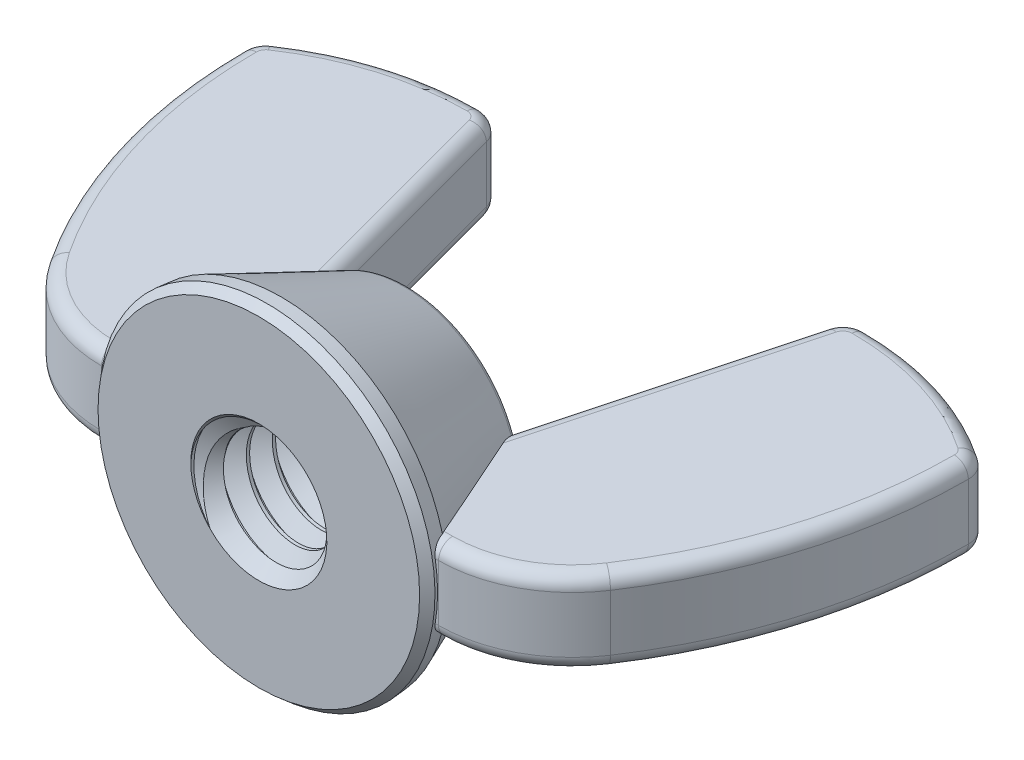
from build123d import *

# Parameters (mm, degrees)
EXTRUDE2_DEPTH     = 1.28984375
SKETCH3_R          = 5.159375
EXTRUDE1_DEPTH     = 0.6858
EXTRUDE1_DRAFT     = -5
SKETCH15_R         = 5.099375275
EXTRUDE3_DEPTH     = 3.8862
EXTRUDE3_TAPER     = 22.89012698
FILLET3_R          = 0.254
SKETCH4_R          = 2.0828
CUT_EXTRUDE1_DEPTH = 18.646438922
SWEEP1_PITCH       = 0.79375
SKETCH7_R          = 5.159375
CUT_EXTRUDE2_DEPTH = 18.646438952
SKETCH8_R          = 5.099375275
CUT_EXTRUDE3_DEPTH = 15.702761362
SKETCH11_R         = 2.032
CUT_EXTRUDE5_DEPTH = 15.702761327
CUT_EXTRUDE5_TAPER = 45
CHAMFER1_SIZE      = 0.257175
CHAMFER1_SIZE2     = 0.237388559
FILLET4_R          = 0.429947917


with BuildPart() as part:
    # Sketch13 → Extrude2 (new, symmetric)
    with BuildSketch(Plane(origin=(0, 0, 0), x_dir=(1, 0, 0), z_dir=(0, 1, 0))):
        with BuildLine():
            Line((3.166712045, 0.3429), (5.159375, 0.3429))
            ThreePointArc((5.159375, 0.3429), (7.101768744, 0.832103373), (8.580723973, 2.182993757))
            ThreePointArc((8.580723973, 2.182993757), (10.465874951, 6.208977734), (11.1125, 10.607183874))
            ThreePointArc((11.1125, 10.607183874), (11.028622602, 10.943597741), (10.796626512, 11.201255503))
            ThreePointArc((10.796626512, 11.201255503), (8.457534763, 12.316945036), (5.894454148, 12.7))
            ThreePointArc((5.894454148, 12.7), (5.458227968, 12.551921165), (5.202291154, 12.168884654))
            Line((5.202291154, 12.168884654), (3.166712045, 4.572))
            Line((3.166712045, 4.572), (3.166712045, 0.3429))
        make_face()
    extrude(amount=EXTRUDE2_DEPTH, both=True)

    # Fillet4
    fillet4_edges = [part.edges().sort_by_distance(p)[0] for p in [
        (7.101768744, 1.28984375, -0.832103373),
        (4.163043523, -1.28984375, -0.3429),
        (10.465874951, 1.28984375, -6.208977734),
        (11.028622602, 1.28984375, -10.943597741),
        (8.457534763, 1.28984375, -12.316945036),
        (5.458227968, 1.28984375, -12.551921165),
        (4.1845016, 1.28984375, -8.370442327),
        (4.163043523, 1.28984375, -0.3429),
        (4.1845016, -1.28984375, -8.370442327),
        (5.458227968, -1.28984375, -12.551921165),
        (8.457534763, -1.28984375, -12.316945036),
        (11.028622602, -1.28984375, -10.943597741),
        (10.465874951, -1.28984375, -6.208977734),
        (7.101768744, -1.28984375, -0.832103373),
    ]]
    fillet(fillet4_edges, radius=FILLET4_R)


with BuildPart() as body_2:
    # Sketch3 → Extrude1 (with draft: the straight prism first)
    with BuildSketch(Plane.XY):
        Circle(SKETCH3_R)
    extrude(amount=-EXTRUDE1_DEPTH)
    # Extrude1: the draft: its side faces are tilted about the plane it starts from
    extrude1_sides = [body_2.faces().sort_by_distance(p)[0] for p in [
        (-5.159375, 0, -0.3429),
    ]]
    draft(extrude1_sides, Plane.XY, EXTRUDE1_DRAFT)

    # Sketch15 → Extrude3 (add)
    with BuildSketch(Plane(origin=(0, 0, -0.6858), x_dir=(-1, 0, 0), z_dir=(0, 0, -1))):
        Circle(SKETCH15_R)
    extrude(amount=EXTRUDE3_DEPTH, taper=EXTRUDE3_TAPER)

    # Fillet3
    fillet3_edges = [body_2.edges().sort_by_distance(p)[0] for p in [
        (3.458569214, 0, -4.572),
    ]]
    fillet(fillet3_edges, radius=FILLET3_R)

    # Sketch4 → Cut-Extrude1 (cut, through all)
    with BuildSketch(Plane.XY):
        Circle(SKETCH4_R)
    extrude(amount=-CUT_EXTRUDE1_DEPTH, mode=Mode.SUBTRACT)

    # Sweep1: the profile of Sketch6 profile screwed along a right-hand helix of 9.76 turns, 6 arcs to a turn; built about Z, then put on its axis
    sweep1_z = Axis((0, 0, 0), (0, 0, 1))
    sweep1_corners = [(2.0831, 0, -0.694704455), (1.567244252, 0, -0.396875), (1.567244252, 0, -0.29765625), (2.0831, 0, 0.000173205)]
    with BuildLine(mode=Mode.PRIVATE) as sweep1_profile:
        Line(sweep1_corners[0], sweep1_corners[1])
        Line(sweep1_corners[1], sweep1_corners[2])
        Line(sweep1_corners[2], sweep1_corners[3])
        Line(sweep1_corners[3], sweep1_corners[0])
    sweep1_cap = Face(sweep1_profile.wire())
    sweep1_turn_angles = [0, 30, 60, 90, 120, 150, 180, 210, 240, 270, 300, 330, 360]
    sweep1_turn_weights = [1, 0.8660254037844387, 1, 0.8660254037844387, 1, 0.8660254037844387, 1, 0.8660254037844387, 1, 0.8660254037844387, 1, 0.8660254037844387, 1]
    sweep1_turn_rails = [Edge.make_bspline([Vector(p[0], p[1], 0).rotate(sweep1_z, sweep1_turn_angles[k]) / sweep1_turn_weights[k] + Vector(0, 0, p[2] + SWEEP1_PITCH * sweep1_turn_angles[k] / 360) for k in range(13)], [0, 0, 0, 1, 1, 2, 2, 3, 3, 4, 4, 5, 5, 6, 6, 6], 2, sweep1_turn_weights) for p in sweep1_corners]
    sweep1_turn_sides = [Face.make_surface_from_curves(sweep1_turn_rails[p[0]], sweep1_turn_rails[p[1]]) for p in [(0, 1), (1, 2), (2, 3), (3, 0)]]
    sweep1_turn = Solid(Shell([*sweep1_turn_sides, sweep1_cap, sweep1_cap.rotate(sweep1_z, 360).moved(Location((0, 0, SWEEP1_PITCH * 360 / 360)))]))
    sweep1_last_angles = [3240, 3270, 3300, 3330, 3360, 3390, 3420, 3450, 3480, 3496.8, 3513.6]
    sweep1_last_weights = [1, 0.8660254037844387, 1, 0.8660254037844387, 1, 0.8660254037844387, 1, 0.8660254037844387, 1, 0.9573194975320675, 1]
    sweep1_last_rails = [Edge.make_bspline([Vector(p[0], p[1], 0).rotate(sweep1_z, sweep1_last_angles[k]) / sweep1_last_weights[k] + Vector(0, 0, p[2] + SWEEP1_PITCH * sweep1_last_angles[k] / 360) for k in range(11)], [0, 0, 0, 1, 1, 2, 2, 3, 3, 4, 4, 5, 5, 5], 2, sweep1_last_weights) for p in sweep1_corners]
    sweep1_last_sides = [Face.make_surface_from_curves(sweep1_last_rails[p[0]], sweep1_last_rails[p[1]]) for p in [(0, 1), (1, 2), (2, 3), (3, 0)]]
    sweep1_last = Solid(Shell([*sweep1_last_sides, sweep1_cap.rotate(sweep1_z, 3240).moved(Location((0, 0, SWEEP1_PITCH * 3240 / 360))), sweep1_cap.rotate(sweep1_z, 3513.6).moved(Location((0, 0, SWEEP1_PITCH * 3513.6 / 360)))]))
    sweep1_each = [*[sweep1_turn.moved(Location((0, 0, SWEEP1_PITCH * i))) for i in range(9)], sweep1_last]
    add(Plane(origin=(0, 0, 0), x_dir=(-1, 0, 0), z_dir=(0, 0, -1)) * Compound([sweep1_each[i] for i in range(0, 10, 2)]))
    add(Plane(origin=(0, 0, 0), x_dir=(-1, 0, 0), z_dir=(0, 0, -1)) * Compound([sweep1_each[i] for i in range(1, 10, 2)]))

    # Sketch7 → Cut-Extrude2 (cut, through all)
    with BuildSketch(Plane.XY):
        Circle(SKETCH7_R)
    extrude(amount=CUT_EXTRUDE2_DEPTH, mode=Mode.SUBTRACT)

    # Sketch8 → Cut-Extrude3 (cut, through all)
    with BuildSketch(Plane.XY.offset(-4.572)):
        Circle(SKETCH8_R)
    extrude(amount=-CUT_EXTRUDE3_DEPTH, mode=Mode.SUBTRACT)

    # Cut-Extrude4 cone 1 section (through the dimple's axis) → Cut-Extrude4 (revolve, cut)
    with BuildSketch(Plane(origin=(0, 0, 0), x_dir=(0, -1, 0), z_dir=(1, 0, 0))):
        Polygon((0, 0), (2.0828, 0), (0, 2.0828), align=None)
    revolve(axis=Axis((0, 0, 0), (0, 0, -1)), mode=Mode.SUBTRACT)

    # Sketch11 → Cut-Extrude5 (cut, through all)
    with BuildSketch(Plane.XY.offset(-4.572)):
        Circle(SKETCH11_R)
    extrude(amount=CUT_EXTRUDE5_DEPTH, taper=CUT_EXTRUDE5_TAPER, mode=Mode.SUBTRACT)

    # Chamfer1
    chamfer1_edges = [body_2.edges().sort_by_distance(p)[0] for p in [
        (-5.159375, 0, 0),
    ]]
    chamfer1_side = [body_2.faces().sort_by_distance(p)[0] for p in [
        (-5.129375137, 0, -0.3429),
    ]]
    chamfer(chamfer1_edges, length=CHAMFER1_SIZE, length2=CHAMFER1_SIZE2, reference=chamfer1_side[0])


with BuildPart() as body_3:
    # Mirror6: mirrored copy
    add(part.part.mirror(Plane(origin=(0, 0, 0), x_dir=(0, 0, 1), z_dir=(1, 0, 0))))

    # Combine2: union part, body 2
    add(part.part)
    add(body_2.part)


solid = body_3.part
